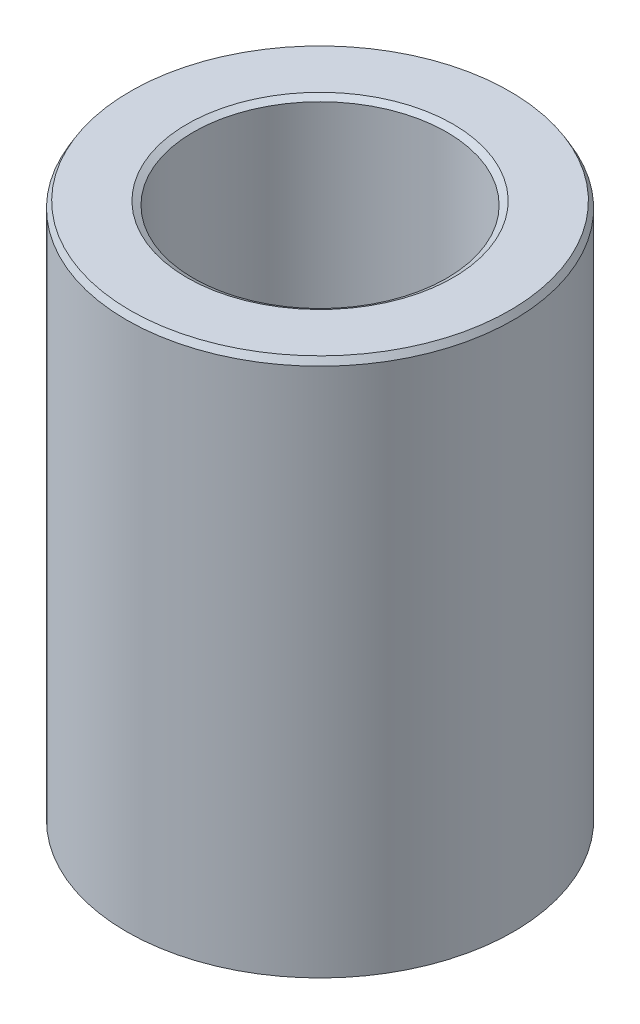
from build123d import *
from OCP.BRepFilletAPI import BRepFilletAPI_MakeChamfer

# Parameters (mm, degrees)
SKETCH1_R           = 37.5
BOSS_EXTRUDE1_DEPTH = 104.640393124
SKETCH2_R           = 24.547072286
CUT_EXTRUDE1_DEPTH  = 118.312027828
CHAMFER1_SIZE       = 1.237432283
CHAMFER1_SIZE2      = 0.714431861


with BuildPart() as part:
    # Sketch1 → Boss-Extrude1 (new body)
    with BuildSketch(Plane(origin=(0, 0, 0), x_dir=(1, 0, 0), z_dir=(0, 1, 0))):
        Circle(SKETCH1_R)
    extrude(amount=BOSS_EXTRUDE1_DEPTH)

    # Sketch2 → Cut-Extrude1 (cut, through all)
    with BuildSketch(Plane(origin=(0, 0, 0), x_dir=(1, 0, 0), z_dir=(0, 1, 0))):
        Circle(SKETCH2_R)
    extrude(amount=CUT_EXTRUDE1_DEPTH, mode=Mode.SUBTRACT)

    # Chamfer1: one chamfer whose edges measure the first distance from different faces: ONE call of the kernel's chamfer builder (chamfer() names one face for all edges)
    chamfer1_edges_1 = [part.edges().sort_by_distance(p)[0] for p in [
        (-24.547072286, 104.640393124, 0),
    ]]
    chamfer1_side_1 = [part.faces().sort_by_distance(p)[0] for p in [
        (-36.439339828, 104.640393124, 0),
    ]]
    chamfer1_edges_2 = [part.edges().sort_by_distance(p)[0] for p in [
        (-24.547072286, 0, 0),
    ]]
    chamfer1_side_2 = [part.faces().sort_by_distance(p)[0] for p in [
        (-24.547072286, 52.320196562, 0),
    ]]
    chamfer1_edges_3 = [part.edges().sort_by_distance(p)[0] for p in [
        (-37.5, 0, 0),
    ]]
    chamfer1_side_3 = [part.faces().sort_by_distance(p)[0] for p in [
        (-36.439339828, 0, 0),
    ]]
    chamfer1_edges_4 = [part.edges().sort_by_distance(p)[0] for p in [
        (-37.5, 104.640393124, 0),
    ]]
    chamfer1_side_4 = [part.faces().sort_by_distance(p)[0] for p in [
        (-37.5, 52.320196562, 0),
    ]]
    chamfer1 = BRepFilletAPI_MakeChamfer(part.part.solid().wrapped)
    for e in chamfer1_edges_1:
        chamfer1.Add(CHAMFER1_SIZE, CHAMFER1_SIZE2, e.wrapped, chamfer1_side_1[0].wrapped)  # the first distance lies on this face
    for e in chamfer1_edges_2:
        chamfer1.Add(CHAMFER1_SIZE, CHAMFER1_SIZE2, e.wrapped, chamfer1_side_2[0].wrapped)  # the first distance lies on this face
    for e in chamfer1_edges_3:
        chamfer1.Add(CHAMFER1_SIZE, CHAMFER1_SIZE2, e.wrapped, chamfer1_side_3[0].wrapped)  # the first distance lies on this face
    for e in chamfer1_edges_4:
        chamfer1.Add(CHAMFER1_SIZE, CHAMFER1_SIZE2, e.wrapped, chamfer1_side_4[0].wrapped)  # the first distance lies on this face
    add(Compound.cast(chamfer1.Shape()), mode=Mode.REPLACE)


solid = part.part
